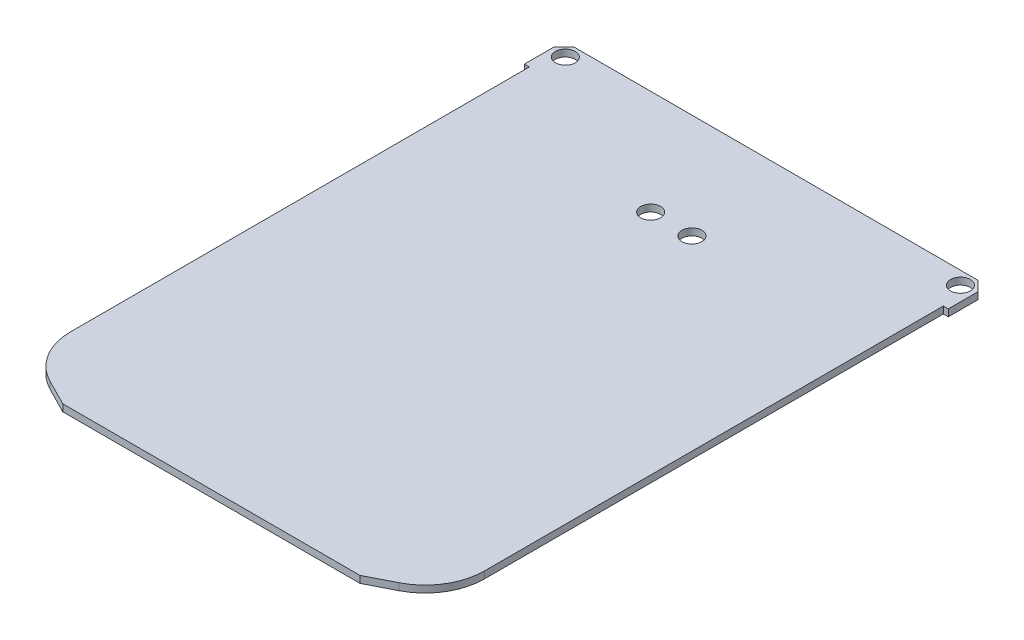
from build123d import *

# Parameters (mm, degrees)
SKETCH1_R           = 1
BOSS_EXTRUDE1_DEPTH = 0.7
SKETCH2_R           = 1
CUT_EXTRUDE1_DEPTH  = 4.5
FILLET1_R           = 6


with BuildPart() as part:
    # Sketch1 → Boss-Extrude1 (new body)
    with BuildSketch(Plane(origin=(0, 0, 0), x_dir=(1, 0, 0), z_dir=(0, 1, 0))):
        Polygon((-21.4, 26.5), (-20.9, 26.5), (-20.9, -23.5), (-15, -26.5), (15, -26.5), (20.9, -23.5), (20.9, 26.5), (21.4, 26.5), (21.4, 29.5), (20.4, 30.5), (-20.4, 30.5), (-21.4, 29.5), align=None)
        with Locations((-19.944365081, 29.181392426)):
            Circle(SKETCH1_R, mode=Mode.SUBTRACT)
        with Locations((19.944365081, 29.181392426)):
            Circle(SKETCH1_R, mode=Mode.SUBTRACT)
    extrude(amount=BOSS_EXTRUDE1_DEPTH)

    # Sketch2 → Cut-Extrude1 (cut)
    with BuildSketch(Plane(origin=(0, 0.7, 0), x_dir=(1, 0, 0), z_dir=(0, 1, 0))):
        with Locations((-2.084530189, 19.934465076)):
            Circle(SKETCH2_R)
        with Locations((2.084530189, 19.934465076)):
            Circle(SKETCH2_R)
    extrude(amount=-CUT_EXTRUDE1_DEPTH, mode=Mode.SUBTRACT)

    # Fillet1
    fillet1_edges = [part.edges().sort_by_distance(p)[0] for p in [
        (20.9, 0.35, 23.5),
        (-20.9, 0.35, 23.5),
    ]]
    fillet(fillet1_edges, radius=FILLET1_R)


solid = part.part
